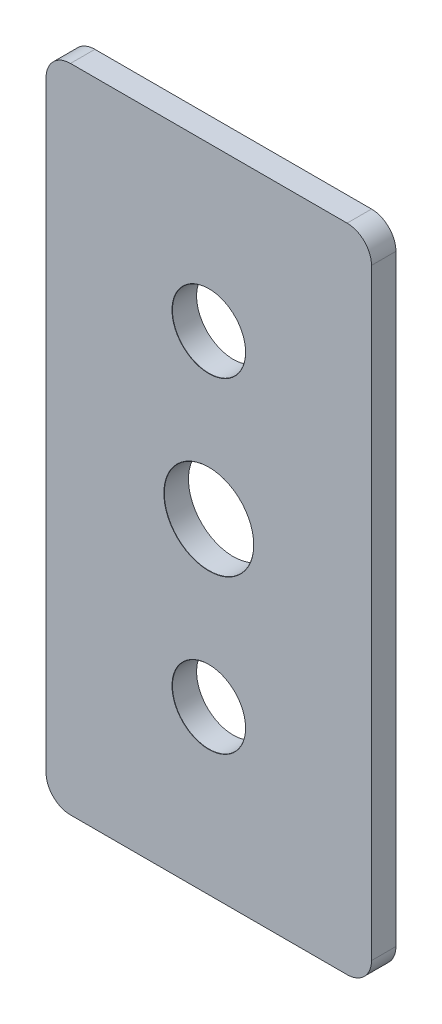
from build123d import *

# Parameters (mm, degrees)
SKETCH_1_W                    = 40
SKETCH_1_H                    = 80
SM_BASE_FLANGE_1_DEPTH        = 3
OTHER_START                   = -3
OTHER_1_DEPTH                 = 3
HOLE_WIZARD_M8_1_D            = 9
HOLE_WIZARD_M8_1_DEPTH        = 12.4
HOLE_WIZARD_M8_1_CSINK_D      = 9.05
HOLE_WIZARD_M8_1_CSINK_ANGLE  = 90
HOLE_WIZARD_M8_1_TIP          = 2.703872786
HOLE_WIZARD_M10_1_D           = 11
HOLE_WIZARD_M10_1_DEPTH       = 12.4
HOLE_WIZARD_M10_1_CSINK_D     = 11.05
HOLE_WIZARD_M10_1_CSINK_ANGLE = 90
HOLE_WIZARD_M10_1_TIP         = 3.304733405


# Read off the part's stored shape, not the designer's step: 断开-边角1
# Sheet-metal steps are written as plain solids
with BuildPart() as part:
    # Sketch 1 → 基体-法兰1 (new body)
    with BuildSketch(Plane.XY):
        Rectangle(SKETCH_1_W, SKETCH_1_H)
    extrude(amount=-SM_BASE_FLANGE_1_DEPTH)

    # Other 1 outline → Other 1 (cut)
    with BuildSketch(Plane.XY.offset(OTHER_START)):
        with BuildLine():
            ThreePointArc((20, -37), (19.121320344, -39.121320344), (17, -40))
            Line((17, -40), (20, -40))
            Line((20, -40), (20, -37))
        make_face()
        with BuildLine():
            Line((-20, -40), (-17, -40))
            ThreePointArc((-17, -40), (-19.121320344, -39.121320344), (-20, -37))
            Line((-20, -37), (-20, -40))
        make_face()
        with BuildLine():
            ThreePointArc((17, 40), (19.121320344, 39.121320344), (20, 37))
            Line((20, 37), (20, 40))
            Line((20, 40), (17, 40))
        make_face()
        with BuildLine():
            Line((-20, 40), (-20, 37))
            ThreePointArc((-20, 37), (-19.121320344, 39.121320344), (-17, 40))
            Line((-17, 40), (-20, 40))
        make_face()
    extrude(amount=OTHER_1_DEPTH, mode=Mode.SUBTRACT)

    # M8 间隙孔1
    with Locations(Plane.XY):
        with Locations((0, 20), (0, -20)):
            CounterSinkHole(HOLE_WIZARD_M8_1_D / 2, HOLE_WIZARD_M8_1_CSINK_D / 2, depth=HOLE_WIZARD_M8_1_DEPTH, counter_sink_angle=HOLE_WIZARD_M8_1_CSINK_ANGLE)
            with Locations((0, 0, -(HOLE_WIZARD_M8_1_DEPTH + HOLE_WIZARD_M8_1_TIP / 2))):  # 118° drill point
                Cone(0, HOLE_WIZARD_M8_1_D / 2, HOLE_WIZARD_M8_1_TIP, mode=Mode.SUBTRACT)

    # M10 间隙孔1
    with Locations(Plane.XY):
        with Locations((0, 0)):
            CounterSinkHole(HOLE_WIZARD_M10_1_D / 2, HOLE_WIZARD_M10_1_CSINK_D / 2, depth=HOLE_WIZARD_M10_1_DEPTH, counter_sink_angle=HOLE_WIZARD_M10_1_CSINK_ANGLE)
            with Locations((0, 0, -(HOLE_WIZARD_M10_1_DEPTH + HOLE_WIZARD_M10_1_TIP / 2))):  # 118° drill point
                Cone(0, HOLE_WIZARD_M10_1_D / 2, HOLE_WIZARD_M10_1_TIP, mode=Mode.SUBTRACT)


solid = part.part
